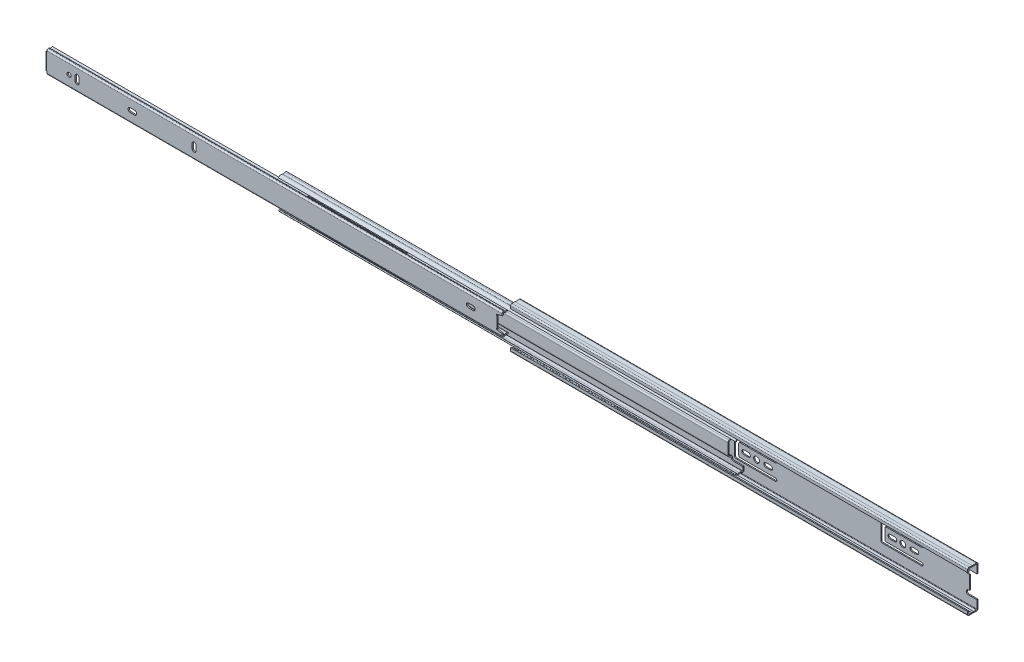
from build123d import *
from build123d.topology import SkipClean

# Parameters (mm, degrees)
EXTRUDE1_DEPTH      = 250.063
MIDDLE_MEMBER_DEPTH = 500.126
DRAWER_START        = -500.126
DRAWER_MEMBER_DEPTH = 500.126
SKETCH6_W           = 1.905
SKETCH6_H           = 12.147486483
CUT_EXTRUDE1_DEPTH  = 759.512762456
EXTRUDE4_DEPTH      = 8.89
CUT_EXTRUDE2_DEPTH  = 1.1938
CUT_EXTRUDE3_DEPTH  = 1.397
CUT_EXTRUDE4_DEPTH  = 759.437671799
CUT_EXTRUDE5_DEPTH  = 1.1938
CUT_EXTRUDE14_DEPTH = 1.1938
CUT_EXTRUDE6_DEPTH  = 1.1938
CUT_E_DEPTH         = 1.1938
SKETCH24_R          = 2.1844
CUT_EXTRUDE13_DEPTH = 1.397
CUT_D_DEPTH         = 1.397
LPATTERN1_COUNT     = 6
LPATTERN1_PITCH     = 19.05
EXTRUDE7_DEPTH      = 6.35
EXTRUDE7_DEPTH_BACK = 101.6
SKETCH28_W          = 7.62
SKETCH28_H          = 0.762
LPATTERN2_COUNT     = 6
LPATTERN2_PITCH     = 19.05
EXTRUDE8_DEPTH      = 6.35
EXTRUDE8_DEPTH_BACK = 101.6
SKETCH30_W          = 5.08
SKETCH30_H          = 0.762


# Read off the part's stored shape, not the designer's step: Drawer Member
with BuildPart() as part:
    # Sketch1 → Extrude1 (new, symmetric)
    with BuildSketch(Plane(origin=(0, 0, 0), x_dir=(0, 0, -1), z_dir=(1, 0, 0))):
        with BuildLine():
            Line((-4.139279899, 22.8203125), (-0.743323143, 22.698920454))
            Line((-0.743323143, 22.698920454), (3.892452069, 22.8203125))
            ThreePointArc((3.892452069, 22.8203125), (5.124499805, 22.338098312), (5.6388, 21.119095664))
            Line((5.6388, 21.119095664), (5.6388, 0))
            Line((5.6388, 0), (4.445, 0))
            Line((4.445, 0), (4.445, 21.119095664))
            ThreePointArc((4.445, 21.119095664), (4.291477554, 21.482977052), (3.92370211, 21.626921585))
            Line((3.92370211, 21.626921585), (0.761857041, 21.544125758))
            ThreePointArc((0.761857041, 21.544125758), (-0.187154328, 21.71413397), (-1.131158407, 21.51822157))
            Line((-1.131158407, 21.51822157), (-4.181926298, 21.627274477))
            ThreePointArc((-4.181926298, 21.627274477), (-4.367367911, 21.55622161), (-4.445, 21.3734366))
            Line((-4.445, 21.3734366), (-4.445, 18.415))
            Line((-4.445, 18.415), (-5.6388, 18.415))
            Line((-5.6388, 18.415), (-5.6388, 21.3734366))
            ThreePointArc((-5.6388, 21.3734366), (-5.19629709, 22.415311161), (-4.139279899, 22.8203125))
        make_face()
    extrude(amount=EXTRUDE1_DEPTH, both=True)

    # Sketch8 → Cut-Extrude2 (cut)
    with BuildSketch(Plane.XY.offset(-4.445)):
        with BuildLine():
            Line((240.424533997, 7.645578895), (241.8588, 7.493000005))
            Line((241.8588, 7.493000005), (241.8588, 0))
            Line((241.8588, 0), (250.063, 0))
            Line((250.063, 0), (250.063, 12.204752384))
            Line((250.063, 12.204752384), (240.666356843, 12.204752384))
            ThreePointArc((240.666356843, 12.204752384), (238.383565723, 10.03983377), (240.424533997, 7.645578895))
        make_face()
    extrude(amount=-CUT_EXTRUDE2_DEPTH, mode=Mode.SUBTRACT)

    # Sketch13 → Cut-Extrude5 (cut)
    with BuildSketch(Plane.XY.offset(-4.445)):
        with BuildLine():
            Line((-181.674699917, 7.112000069), (-206.503199931, 7.112000069))
            ThreePointArc((-206.503199931, 7.112000069), (-207.042015347, 6.888815416), (-207.2652, 6.35))
            Line((-207.2652, 6.35), (-207.2652, 0))
            Line((-207.2652, 0), (-209.5512, 0))
            Line((-209.5512, 0), (-209.5512, 6.35))
            ThreePointArc((-209.5512, 6.35), (-209.774384653, 6.888815416), (-210.313200069, 7.112000069))
            Line((-210.313200069, 7.112000069), (-232.601699917, 7.112000069))
            ThreePointArc((-232.601699917, 7.112000069), (-234.189199917, 8.699500069), (-232.601699917, 10.287000069))
            Line((-232.601699917, 10.287000069), (-181.674699917, 10.287000069))
            ThreePointArc((-181.674699917, 10.287000069), (-180.087199917, 8.699500069), (-181.674699917, 7.112000069))
        make_face()
        with BuildLine():
            Line((-187.288099917, 2.286), (-192.241099917, 2.286))
            ThreePointArc((-192.241099917, 2.286), (-193.857546018, 1.616446102), (-194.527099917, 0))
            Line((-194.527099917, 0), (-185.002099917, 0))
            ThreePointArc((-185.002099917, 0), (-185.671653815, 1.616446102), (-187.288099917, 2.286))
        make_face()
        with BuildLine():
            Line((-226.340599917, 0), (-221.768599917, 0))
            ThreePointArc((-221.768599917, 0), (-224.054599917, 2.286), (-226.340599917, 0))
        make_face()
        with BuildLine():
            Line((-218.238000083, 0), (-211.887999917, 0))
            ThreePointArc((-211.887999917, 0), (-215.063, 3.175000083), (-218.238000083, 0))
        make_face()
        with BuildLine():
            Line((-204.750599917, 0), (-200.178599917, 0))
            ThreePointArc((-200.178599917, 0), (-202.464599917, 2.286), (-204.750599917, 0))
        make_face()
    extrude(amount=-CUT_EXTRUDE5_DEPTH, mode=Mode.SUBTRACT)

    # Sketch32 → Cut-Extrude14 (cut)
    with BuildSketch(Plane(origin=(0, 0, -5.6388), x_dir=(-1, 0, 0), z_dir=(0, 0, -1))):
        with BuildLine():
            Line((69.6005, 0), (79.1255, 0))
            ThreePointArc((79.1255, 0), (78.455946102, 1.616446102), (76.8395, 2.286))
            Line((76.8395, 2.286), (71.8865, 2.286))
            ThreePointArc((71.8865, 2.286), (70.270053898, 1.616446102), (69.6005, 0))
        make_face()
        with BuildLine():
            Line((83.888, 0), (90.238, 0))
            ThreePointArc((90.238, 0), (87.063, 3.175), (83.888, 0))
        make_face()
        with BuildLine():
            Line((93.7305, 0), (103.2555, 0))
            ThreePointArc((103.2555, 0), (102.585946102, 1.616446102), (100.9695, 2.286))
            Line((100.9695, 2.286), (96.0165, 2.286))
            ThreePointArc((96.0165, 2.286), (94.400053898, 1.616446102), (93.7305, 0))
        make_face()
        with BuildLine():
            Line((106.621, 0), (111.193, 0))
            Line((111.193, 0), (111.193, 8.763000069))
            ThreePointArc((111.193, 8.763000069), (110.746630735, 9.840630803), (109.669, 10.287000069))
            Line((109.669, 10.287000069), (66.4255, 10.287000069))
            ThreePointArc((66.4255, 10.287000069), (64.838, 8.699500069), (66.4255, 7.112000069))
            Line((66.4255, 7.112000069), (105.097, 7.112000069))
            ThreePointArc((105.097, 7.112000069), (106.174630735, 6.665630803), (106.621, 5.588000069))
            Line((106.621, 5.588000069), (106.621, 0))
        make_face()
    extrude(amount=-CUT_EXTRUDE14_DEPTH, mode=Mode.SUBTRACT)

    # Sketch33 → Cut-Extrude6 (cut)
    with BuildSketch(Plane(origin=(83.609365602, 0.812450965, -5.6388), x_dir=(-1, 0, 0), z_dir=(0, 0, -1))):
        with BuildLine():
            Line((57.209865602, -0.812450965), (66.734865602, -0.812450965))
            ThreePointArc((66.734865602, -0.812450965), (66.065311704, 0.803995136), (64.448865602, 1.473549035))
            Line((64.448865602, 1.473549035), (59.495865602, 1.473549035))
            ThreePointArc((59.495865602, 1.473549035), (57.8794195, 0.803995136), (57.209865602, -0.812450965))
        make_face()
        with BuildLine():
            Line((71.497365602, -0.812450965), (77.847365602, -0.812450965))
            ThreePointArc((77.847365602, -0.812450965), (74.672365602, 2.362549035), (71.497365602, -0.812450965))
        make_face()
        with BuildLine():
            Line((81.339865602, -0.812450965), (90.864865602, -0.812450965))
            ThreePointArc((90.864865602, -0.812450965), (90.195311704, 0.803995136), (88.578865602, 1.473549035))
            Line((88.578865602, 1.473549035), (83.625865602, 1.473549035))
            ThreePointArc((83.625865602, 1.473549035), (82.0094195, 0.803995136), (81.339865602, -0.812450965))
        make_face()
        with BuildLine():
            Line((94.230365602, -0.812450965), (98.802365602, -0.812450965))
            Line((98.802365602, -0.812450965), (98.802365602, 7.950549103))
            ThreePointArc((98.802365602, 7.950549103), (98.355996337, 9.028179838), (97.278365602, 9.474549103))
            Line((97.278365602, 9.474549103), (54.034865602, 9.474549103))
            ThreePointArc((54.034865602, 9.474549103), (52.447365602, 7.887049103), (54.034865602, 6.299549103))
            Line((54.034865602, 6.299549103), (92.706365602, 6.299549103))
            ThreePointArc((92.706365602, 6.299549103), (93.783996337, 5.853179838), (94.230365602, 4.775549103))
            Line((94.230365602, 4.775549103), (94.230365602, -0.812450965))
        make_face()
    extrude(amount=-CUT_EXTRUDE6_DEPTH, mode=Mode.SUBTRACT)

    # Sketch34 → Cut E (cut)
    with BuildSketch(Plane(origin=(169.823604257, 1.452669916, -5.6388), x_dir=(-1, 0, 0), z_dir=(0, 0, -1))):
        with BuildLine():
            Line((-16.623895743, -1.452669916), (-7.098895743, -1.452669916))
            ThreePointArc((-7.098895743, -1.452669916), (-7.768449642, 0.163776186), (-9.384895743, 0.833330084))
            Line((-9.384895743, 0.833330084), (-14.337895743, 0.833330084))
            ThreePointArc((-14.337895743, 0.833330084), (-15.954341845, 0.163776186), (-16.623895743, -1.452669916))
        make_face()
        with BuildLine():
            Line((-2.336395743, -1.452669916), (4.013604257, -1.452669916))
            ThreePointArc((4.013604257, -1.452669916), (0.838604257, 1.722330084), (-2.336395743, -1.452669916))
        make_face()
        with BuildLine():
            Line((7.506104257, -1.452669916), (17.031104257, -1.452669916))
            ThreePointArc((17.031104257, -1.452669916), (16.361550358, 0.163776186), (14.745104257, 0.833330084))
            Line((14.745104257, 0.833330084), (9.792104257, 0.833330084))
            ThreePointArc((9.792104257, 0.833330084), (8.175658155, 0.163776186), (7.506104257, -1.452669916))
        make_face()
        with BuildLine():
            Line((20.396604257, -1.452669916), (24.968604257, -1.452669916))
            Line((24.968604257, -1.452669916), (24.968604257, 7.310330153))
            ThreePointArc((24.968604257, 7.310330153), (24.522234991, 8.387960887), (23.444604257, 8.834330153))
            Line((23.444604257, 8.834330153), (-19.798895743, 8.834330153))
            ThreePointArc((-19.798895743, 8.834330153), (-21.386395743, 7.246830153), (-19.798895743, 5.659330153))
            Line((-19.798895743, 5.659330153), (18.872604257, 5.659330153))
            ThreePointArc((18.872604257, 5.659330153), (19.950234991, 5.212960887), (20.396604257, 4.135330153))
            Line((20.396604257, 4.135330153), (20.396604257, -1.452669916))
        make_face()
    extrude(amount=-CUT_E_DEPTH, mode=Mode.SUBTRACT)

    # Mirror3 3: part across plane


with BuildPart() as body_2:
    # Sketch2 → Middle Member (new body)
    with BuildSketch(Plane.ZY.offset(504.063)):
        with BuildLine():
            ThreePointArc((5.7404, 15.627692517), (3.735864231, 17.127444277), (1.241474216, 16.914283663))
            ThreePointArc((1.241474216, 16.914283663), (-0.188944013, 16.688900955), (-1.505642365, 17.291560999))
            ThreePointArc((-1.505642365, 17.291560999), (-2.813430342, 17.487614783), (-3.53059999, 16.376572852))
            Line((-3.53059999, 16.376572852), (-3.53059999, 9.521737984))
            ThreePointArc((-3.53059999, 9.521737984), (-3.220327109, 8.457239952), (-2.386691239, 7.726160915))
            Line((-2.386691239, 7.726160915), (-0.414564934, 6.806543316))
            ThreePointArc((-0.414564934, 6.806543316), (-0.093935732, 6.525359052), (0.0254, 6.115936705))
            Line((0.0254, 6.115936705), (0.0254, 0))
            Line((0.0254, 0), (1.2446, 0))
            Line((1.2446, 0), (1.2446, 6.115936705))
            ThreePointArc((1.2446, 6.115936705), (0.934327119, 7.180434735), (0.100691251, 7.91151377))
            Line((0.100691251, 7.91151377), (-1.871435054, 8.831131369))
            ThreePointArc((-1.871435054, 8.831131369), (-2.192064258, 9.112315634), (-2.31139999, 9.521737984))
            Line((-2.31139999, 9.521737984), (-2.31139999, 16.376572852))
            ThreePointArc((-2.31139999, 16.376572852), (-2.311399987, 16.376572856), (-2.311399982, 16.376572855))
            ThreePointArc((-2.311399982, 16.376572855), (-0.35482671, 15.481038557), (1.770730805, 15.815950333))
            ThreePointArc((1.770730805, 15.815950333), (3.400639083, 15.955235789), (4.710462095, 14.975253591))
            Line((4.710462095, 14.975253591), (5.7404, 15.627692517))
        make_face()
    extrude(amount=-MIDDLE_MEMBER_DEPTH)

    # Sketch12 → Cut-Extrude4 (cut, through all)
    with BuildSketch(Plane.XY.offset(1.2446)):
        with BuildLine():
            Line((-3.937, 12.065), (-14.097, 12.065))
            ThreePointArc((-14.097, 12.065), (-15.893051224, 11.321051224), (-16.637, 9.525))
            Line((-16.637, 9.525), (-16.637, 0))
            Line((-16.637, 0), (-3.937, 0))
            Line((-3.937, 0), (-3.937, 12.065))
        make_face()
    extrude(amount=-CUT_EXTRUDE4_DEPTH, mode=Mode.SUBTRACT)

    # Mirror3 2: body 2 across plane


with BuildPart() as body_3:
    # Drawer Member outline → Drawer Member (new body)
    with BuildSketch(Plane.ZY.offset(758.063).offset(DRAWER_START)):
        with BuildLine():
            Line((5.6642, 0), (7.0612, 0))
            Line((7.0612, 0), (7.0612, 10.623486483))
            ThreePointArc((7.0612, 10.623486483), (6.614830734, 11.701117218), (5.5372, 12.147486483))
            Line((5.5372, 12.147486483), (5.164341455, 12.147486483))
            ThreePointArc((5.164341455, 12.147486483), (4.67440708, 12.066587417), (4.236487447, 11.83247901))
            ThreePointArc((4.236487447, 11.83247901), (2.709144677, 11.334862777), (1.208194452, 11.907179363))
            Line((1.208194452, 11.907179363), (0.304054167, 10.842219578))
            ThreePointArc((0.304054167, 10.842219578), (2.674694689, 9.938287609), (5.087020295, 10.724235863))
            ThreePointArc((5.087020295, 10.724235863), (5.123513594, 10.743744895), (5.164341455, 10.750486483))
            Line((5.164341455, 10.750486483), (5.5372, 10.750486483))
            ThreePointArc((5.5372, 10.750486483), (5.627002561, 10.713289044), (5.6642, 10.623486483))
            Line((5.6642, 10.623486483), (5.6642, 0))
        make_face()
    extrude(amount=DRAWER_MEMBER_DEPTH)

    # Sketch6 → Cut-Extrude1 (cut, through all)
    with BuildSketch(Plane.XY.offset(7.0612)):
        with Locations((-757.1105, 6.073743242)):
            Rectangle(SKETCH6_W, SKETCH6_H)
    extrude(amount=-CUT_EXTRUDE1_DEPTH, mode=Mode.SUBTRACT)

    # Sketch7 → Extrude4 (add)
    with BuildSketch(Plane.XZ):
        with BuildLine():
            Line((-756.158, 7.0612), (-756.412, 7.0612))
            ThreePointArc((-756.412, 7.0612), (-757.579433296, 6.577633296), (-758.063, 5.4102))
            Line((-758.063, 5.4102), (-758.063, 0.304054167))
            Line((-758.063, 0.304054167), (-756.666, 0.304054167))
            Line((-756.666, 0.304054167), (-756.666, 5.4102))
            ThreePointArc((-756.666, 5.4102), (-756.591605122, 5.589805122), (-756.412, 5.6642))
            Line((-756.412, 5.6642), (-756.158, 5.6642))
            Line((-756.158, 5.6642), (-756.158, 7.0612))
        make_face()
    extrude(amount=-EXTRUDE4_DEPTH)

    # Sketch11 → Cut-Extrude3 (cut)
    with BuildSketch(Plane.XY.offset(7.0612)):
        with BuildLine():
            Line((-263.651951398, 5.967847879), (-263.652, 0))
            Line((-263.652, 0), (-257.937, 0))
            Line((-257.937, 0), (-257.937, 8.589285844))
            Line((-257.937, 8.589285844), (-263.796326457, 7.221216084))
            ThreePointArc((-263.796326457, 7.221216084), (-264.282774848, 6.530182899), (-263.651951398, 5.967847879))
        make_face()
    extrude(amount=-CUT_EXTRUDE3_DEPTH, mode=Mode.SUBTRACT)

    # Sketch24 → Cut-Extrude13 (cut)
    with BuildSketch(Plane.XY.offset(7.0612)):
        with Locations((-731.901, 0)):
            Circle(SKETCH24_R)
        with BuildLine():
            Line((-725.1954, 2.6416), (-725.1954, 0))
            Line((-725.1954, 0), (-720.8266, 0))
            Line((-720.8266, 0), (-720.8266, 2.6416))
            ThreePointArc((-720.8266, 2.6416), (-723.011, 4.826), (-725.1954, 2.6416))
        make_face()
        with BuildLine():
            Line((-667.3215, 0), (-657.7965, 0))
            ThreePointArc((-657.7965, 0), (-658.466053898, 1.616446102), (-660.0825, 2.286))
            Line((-660.0825, 2.286), (-665.0355, 2.286))
            ThreePointArc((-665.0355, 2.286), (-666.651946102, 1.616446102), (-667.3215, 0))
        make_face()
        with BuildLine():
            Line((-597.1954, 2.6416), (-597.1954, 0))
            Line((-597.1954, 0), (-592.8266, 0))
            Line((-592.8266, 0), (-592.8266, 2.6416))
            ThreePointArc((-592.8266, 2.6416), (-595.011, 4.826), (-597.1954, 2.6416))
        make_face()
    extrude(amount=-CUT_EXTRUDE13_DEPTH, mode=Mode.SUBTRACT)

    # Sketch25 → Cut D (cut)
    with BuildSketch(Plane.XY.offset(7.0612)):
        with BuildLine():
            Line((-287.4645, 0), (-296.9895, 0))
            ThreePointArc((-296.9895, 0), (-296.319946102, 1.616446102), (-294.7035, 2.286))
            Line((-294.7035, 2.286), (-289.7505, 2.286))
            ThreePointArc((-289.7505, 2.286), (-288.134053898, 1.616446102), (-287.4645, 0))
        make_face()
    extrude(amount=-CUT_D_DEPTH, mode=Mode.SUBTRACT)

    # Mirror3: body 3 across plane


with BuildPart() as body_4:
    # Sketch27 → Revolve1 (revolve)
    with BuildSketch(Plane.ZY.offset(237.363)):
        with BuildLine():
            Line((0.1524, 21.683172421), (0.1524, 16.665571078))
            ThreePointArc((0.1524, 16.665571078), (2.661200671, 19.174371749), (0.1524, 21.683172421))
        make_face()
    revolve(axis=Axis((-237.363, 23.635004298, 0.1524), (0, -1, 0)))


with BuildPart() as lpattern1_1:
    # LPattern1: pattern copy
    add(body_4.part.moved(Location(Vector(1, 0, 0) * (1 * LPATTERN1_PITCH))))


with BuildPart() as lpattern1_2:
    # LPattern1: pattern copy
    add(body_4.part.moved(Location(Vector(1, 0, 0) * (2 * LPATTERN1_PITCH))))


with BuildPart() as lpattern1_3:
    # LPattern1: pattern copy
    add(body_4.part.moved(Location(Vector(1, 0, 0) * (3 * LPATTERN1_PITCH))))


with BuildPart() as lpattern1_4:
    # LPattern1: pattern copy
    add(body_4.part.moved(Location(Vector(1, 0, 0) * (4 * LPATTERN1_PITCH))))


with BuildPart() as lpattern1_5:
    # LPattern1: pattern copy
    add(body_4.part.moved(Location(Vector(1, 0, 0) * (5 * LPATTERN1_PITCH))))


with BuildPart() as body_4_1:
    add(body_4.part)

    add(lpattern1_1.part)  # Extrude7 merges LPattern1_1

    add(lpattern1_2.part)  # Extrude7 merges LPattern1_2

    add(lpattern1_3.part)  # Extrude7 merges LPattern1_3

    add(lpattern1_4.part)  # Extrude7 merges LPattern1_4

    add(lpattern1_5.part)  # Extrude7 merges LPattern1_5
    # Sketch28 → Extrude7 (add, two sides: drawn at the far end of the back side and taken through both)
    with BuildSketch(Plane.ZY.offset(237.363).offset(-EXTRUDE7_DEPTH_BACK)):
        with Locations((0.1524, 19.174371749)):
            Rectangle(SKETCH28_W, SKETCH28_H)
    extrude(amount=EXTRUDE7_DEPTH + EXTRUDE7_DEPTH_BACK)


with BuildPart() as body_5:
    # Sketch29 → Revolve2 (revolve)
    with BuildSketch(Plane.ZY.offset(465.963)):
        with BuildLine():
            Line((2.7686, 16.043834368), (2.7686, 11.446434358))
            ThreePointArc((2.7686, 11.446434358), (5.067300005, 13.745134363), (2.7686, 16.043834368))
        make_face()
    revolve(axis=Axis((-465.963, 16.680143034, 2.7686), (0, -1, 0)))


with BuildPart() as lpattern2_1:
    # LPattern2: pattern copy
    add(body_5.part.moved(Location(Vector(1, 0, 0) * (1 * LPATTERN2_PITCH))))


with BuildPart() as lpattern2_2:
    # LPattern2: pattern copy
    add(body_5.part.moved(Location(Vector(1, 0, 0) * (2 * LPATTERN2_PITCH))))


with BuildPart() as lpattern2_3:
    # LPattern2: pattern copy
    add(body_5.part.moved(Location(Vector(1, 0, 0) * (3 * LPATTERN2_PITCH))))


with BuildPart() as lpattern2_4:
    # LPattern2: pattern copy
    add(body_5.part.moved(Location(Vector(1, 0, 0) * (4 * LPATTERN2_PITCH))))


with BuildPart() as lpattern2_5:
    # LPattern2: pattern copy
    add(body_5.part.moved(Location(Vector(1, 0, 0) * (5 * LPATTERN2_PITCH))))


with BuildPart() as body_5_1:
    add(body_5.part)

    add(lpattern2_1.part)  # Extrude8 merges LPattern2_1

    add(lpattern2_2.part)  # Extrude8 merges LPattern2_2

    add(lpattern2_3.part)  # Extrude8 merges LPattern2_3

    add(lpattern2_4.part)  # Extrude8 merges LPattern2_4

    add(lpattern2_5.part)  # Extrude8 merges LPattern2_5
    # Sketch30 → Extrude8 (add, two sides: drawn at the far end of the back side and taken through both)
    with BuildSketch(Plane.ZY.offset(465.963).offset(-EXTRUDE8_DEPTH_BACK)):
        with Locations((2.7686, 13.745134363)):
            Rectangle(SKETCH30_W, SKETCH30_H)
    extrude(amount=EXTRUDE8_DEPTH + EXTRUDE8_DEPTH_BACK)


with BuildPart() as body_3_1:
    with SkipClean():  # the faces are left unmerged after this step: merging them gives an invalid solid
        add(body_3.part)
        add(body_3.part.mirror(Plane.ZX))


with BuildPart() as body_2_1:
    add(body_2.part)
    add(body_2.part.mirror(Plane.ZX))


with BuildPart() as part_1:
    with SkipClean():  # the faces are left unmerged after this step: merging them gives an invalid solid
        add(part.part)
        add(part.part.mirror(Plane.ZX))


with BuildPart() as body_6:
    # Mirror5: mirrored copy
    add(body_5_1.part.mirror(Plane.ZX))


with BuildPart() as body_7:
    # Mirror5 2: mirrored copy
    add(body_4_1.part.mirror(Plane.ZX))


solid = Compound([body_4_1.part, body_5_1.part, body_3_1.part, body_2_1.part, part_1.part, body_6.part, body_7.part])
